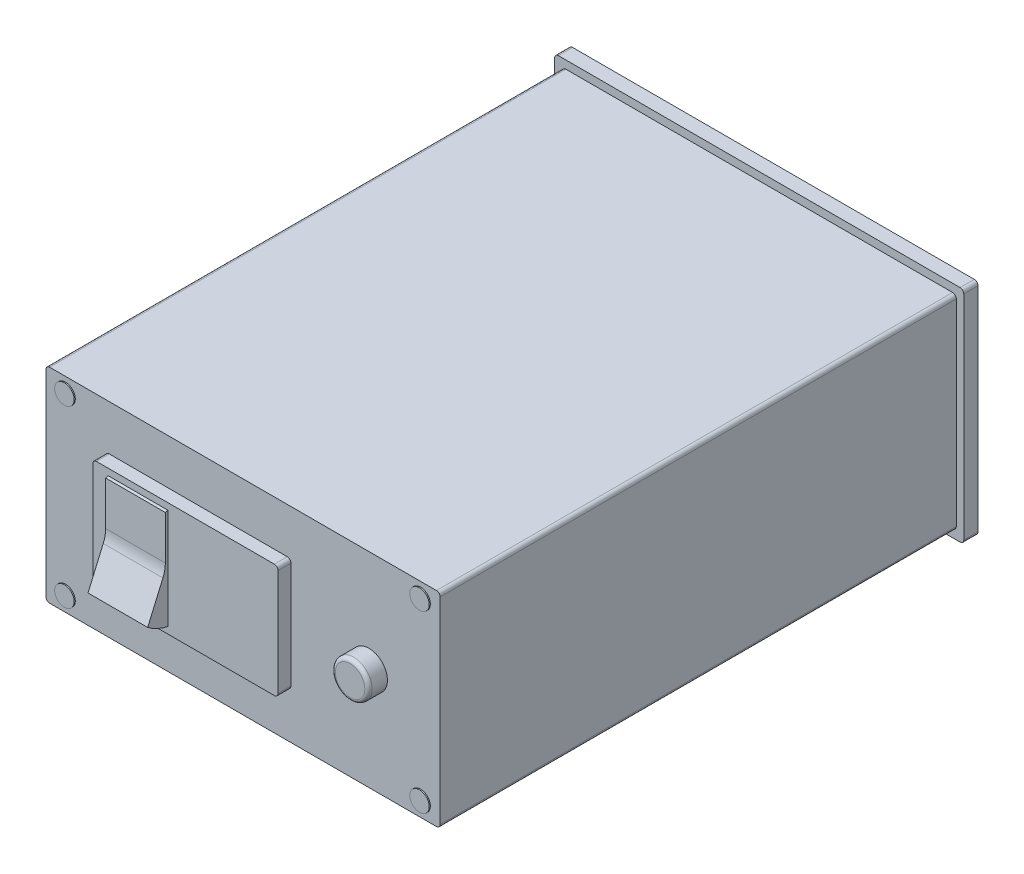
from build123d import *

# Parameters (mm, degrees)
SKETCH1_W               = 111.06
SKETCH1_H               = 59.85
FACE_2_DEPTH            = 3.86
FACE_FILLETS_R          = 1
SKETCH2_W               = 107
SKETCH2_H               = 55.5
BODY_DEPTH              = 144
SKETCH3_W               = 12.75
SKETCH3_H               = 12.75
FEET_DEPTH              = 3.33
FEET_DRAFT              = 25
FEET_PROFILE_2_DEPTH    = 3.33
FEET_PROFILE_2_DRAFT    = 25
FEET_PROFILE_3_DEPTH    = 3.33
FEET_PROFILE_3_DRAFT    = 25
FEET_PROFILE_4_DEPTH    = 3.33
FEET_PROFILE_4_DRAFT    = 25
BODY_FILLETS_R          = 1
SKETCH4_R               = 5
GND_BANNANA_PORT_DEPTH  = 5.15
FILLET3_R               = 1
SKETCH5_W               = 50.3
SKETCH5_H               = 30.9
POWER_PORT_DEPTH        = 3.5
FILLET4_R               = 1
BOSS_EXTRUDE6_DEPTH     = 8.1
SKETCH7_R               = 6.5
BOSS_EXTRUDE7_DEPTH     = 2.35
SKETCH8_R               = 2.65
BOSS_EXTRUDE8_DEPTH     = 0.3
MIRROR2_COPY_1_SKETCH_R = 2.65
MIRROR2_COPY_1_DEPTH    = 0.3
MIRROR2_COPY_2_SKETCH_R = 2.65
MIRROR2_COPY_2_DEPTH    = 0.3


with BuildPart() as part:
    # Sketch1 → Face 2 (new body)
    with BuildSketch(Plane.XY):
        Rectangle(SKETCH1_W, SKETCH1_H)
    extrude(amount=FACE_2_DEPTH)

    # Face Fillets
    face_fillets_edges = [part.edges().sort_by_distance(p)[0] for p in [
        (-55.53, 29.925, 1.93),
        (-55.53, -29.925, 1.93),
        (55.53, -29.925, 1.93),
        (55.53, 29.925, 1.93),
    ]]
    fillet(face_fillets_edges, radius=FACE_FILLETS_R)

    # Sketch2 → Body (add)
    with BuildSketch(Plane.XY):
        Rectangle(SKETCH2_W, SKETCH2_H)
    extrude(amount=BODY_DEPTH)


with BuildPart() as feet_tool:
    # Sketch3 → Feet (with draft: the straight prism first)
    with BuildSketch(Plane.XZ.offset(27.75)):
        with Locations((-36.625, 125.75)):
            Rectangle(SKETCH3_W, SKETCH3_H)
    extrude(amount=FEET_DEPTH)
    # Feet: the draft: its side faces are tilted about the plane it starts from
    feet_sides = [feet_tool.faces().sort_by_distance(p)[0] for p in [
        (-36.625, -29.415, 119.375),
        (-30.25, -29.415, 125.75),
        (-36.625, -29.415, 132.125),
        (-43, -29.415, 125.75),
    ]]
    draft(feet_sides, Plane.XZ.offset(27.75), FEET_DRAFT)


with BuildPart() as part_1:
    add(part.part)

    # Feet: add feet_tool
    add(feet_tool.part)


with BuildPart() as feet_profile_2_tool:
    # Sketch3 → Feet profile 2 (with draft: the straight prism first)
    with BuildSketch(Plane.XZ.offset(27.75)):
        with Locations((36.625, 125.75)):
            Rectangle(SKETCH3_W, SKETCH3_H)
    extrude(amount=FEET_PROFILE_2_DEPTH)
    # Feet profile 2: the draft: its side faces are tilted about the plane it starts from
    feet_profile_2_sides = [feet_profile_2_tool.faces().sort_by_distance(p)[0] for p in [
        (36.625, -29.415, 119.375),
        (43, -29.415, 125.75),
        (36.625, -29.415, 132.125),
        (30.25, -29.415, 125.75),
    ]]
    draft(feet_profile_2_sides, Plane.XZ.offset(27.75), FEET_PROFILE_2_DRAFT)


with BuildPart() as part_2:
    add(part_1.part)

    # Feet profile 2: add feet_profile_2_tool
    add(feet_profile_2_tool.part)


with BuildPart() as feet_profile_3_tool:
    # Sketch3 → Feet profile 3 (with draft: the straight prism first)
    with BuildSketch(Plane.XZ.offset(27.75)):
        with Locations((36.625, 18.86)):
            Rectangle(SKETCH3_W, SKETCH3_H)
    extrude(amount=FEET_PROFILE_3_DEPTH)
    # Feet profile 3: the draft: its side faces are tilted about the plane it starts from
    feet_profile_3_sides = [feet_profile_3_tool.faces().sort_by_distance(p)[0] for p in [
        (36.625, -29.415, 12.485),
        (43, -29.415, 18.86),
        (36.625, -29.415, 25.235),
        (30.25, -29.415, 18.86),
    ]]
    draft(feet_profile_3_sides, Plane.XZ.offset(27.75), FEET_PROFILE_3_DRAFT)


with BuildPart() as part_3:
    add(part_2.part)

    # Feet profile 3: add feet_profile_3_tool
    add(feet_profile_3_tool.part)


with BuildPart() as feet_profile_4_tool:
    # Sketch3 → Feet profile 4 (with draft: the straight prism first)
    with BuildSketch(Plane.XZ.offset(27.75)):
        with Locations((-36.625, 18.86)):
            Rectangle(SKETCH3_W, SKETCH3_H)
    extrude(amount=FEET_PROFILE_4_DEPTH)
    # Feet profile 4: the draft: its side faces are tilted about the plane it starts from
    feet_profile_4_sides = [feet_profile_4_tool.faces().sort_by_distance(p)[0] for p in [
        (-36.625, -29.415, 12.485),
        (-30.25, -29.415, 18.86),
        (-36.625, -29.415, 25.235),
        (-43, -29.415, 18.86),
    ]]
    draft(feet_profile_4_sides, Plane.XZ.offset(27.75), FEET_PROFILE_4_DRAFT)


with BuildPart() as part_4:
    add(part_3.part)

    # Feet profile 4: add feet_profile_4_tool
    add(feet_profile_4_tool.part)

    # Body Fillets
    body_fillets_edges = [part_4.edges().sort_by_distance(p)[0] for p in [
        (53.5, 27.75, 73.93),
        (53.5, -27.75, 73.93),
        (-53.5, -27.75, 73.93),
        (-53.5, 27.75, 73.93),
    ]]
    fillet(body_fillets_edges, radius=BODY_FILLETS_R)

    # Sketch4 → GND Bannana Port (add)
    with BuildSketch(Plane.XY.offset(144)):
        with Locations((34.2, 0)):
            Circle(SKETCH4_R)
    extrude(amount=GND_BANNANA_PORT_DEPTH)

    # Fillet3
    fillet3_edges = [part_4.edges().sort_by_distance(p)[0] for p in [
        (29.2, 0, 149.15),
    ]]
    fillet(fillet3_edges, radius=FILLET3_R)

    # Sketch5 → Power Port (add)
    with BuildSketch(Plane.XY.offset(144)):
        with Locations((-12.15, 0)):
            Rectangle(SKETCH5_W, SKETCH5_H)
    extrude(amount=POWER_PORT_DEPTH)

    # Fillet4
    fillet4_edges = [part_4.edges().sort_by_distance(p)[0] for p in [
        (-37.3, 15.45, 145.75),
        (-37.3, -15.45, 145.75),
        (13, -15.45, 145.75),
        (13, 15.45, 145.75),
    ]]
    fillet(fillet4_edges, radius=FILLET4_R)

    # Sketch6 → Boss-Extrude6 (add, symmetric)
    with BuildSketch(Plane(origin=(-25, 0, 0), x_dir=(0, 0, -1), z_dir=(1, 0, 0))):
        with BuildLine():
            Line((-148.2, 13.502222039), (-148.2, 1.62259302))
            ThreePointArc((-148.2, 1.62259302), (-148.366278541, 0), (-148.858202027, -1.55514242))
            Line((-148.858202027, -1.55514242), (-153, -11.124297731))
            ThreePointArc((-153, -11.124297731), (-130.758589265, -2.678363494), (-148.2, 13.502222039))
        make_face()
    extrude(amount=BOSS_EXTRUDE6_DEPTH, both=True)

    # Sketch7 → Boss-Extrude7 (add, symmetric)
    with BuildSketch(Plane(origin=(0, 0, 0), x_dir=(-1, 0, 0), z_dir=(0, 0, -1))):
        with Locations((-34.53, -2.925)):
            Circle(SKETCH7_R)
    extrude(amount=BOSS_EXTRUDE7_DEPTH, both=True)

    # Sketch8 → Boss-Extrude8 (add, symmetric)
    with BuildSketch(Plane.XY.offset(144)):
        with Locations((-48.2, 23.75)):
            Circle(SKETCH8_R)
    boss_extrude8 = extrude(amount=BOSS_EXTRUDE8_DEPTH, both=True)

    # Mirror1: Boss-Extrude8 across plane
    add(boss_extrude8.mirror(Plane(origin=(0, 0, 0), x_dir=(0, 0, 1), z_dir=(1, 0, 0))))

    # Mirror2 copy 1 sketch → Mirror2 copy 1 (add, symmetric)
    with BuildSketch(Plane(origin=(0, 0, 144), x_dir=(-1, 0, 0), z_dir=(0, 0, 1))):
        with Locations((-48.2, 23.75)):
            Circle(MIRROR2_COPY_1_SKETCH_R)
    extrude(amount=MIRROR2_COPY_1_DEPTH, both=True)

    # Mirror2 copy 2 sketch → Mirror2 copy 2 (add, symmetric)
    with BuildSketch(Plane.XY.offset(144)):
        with Locations((-48.2, -23.75)):
            Circle(MIRROR2_COPY_2_SKETCH_R)
    extrude(amount=MIRROR2_COPY_2_DEPTH, both=True)


solid = part_4.part
